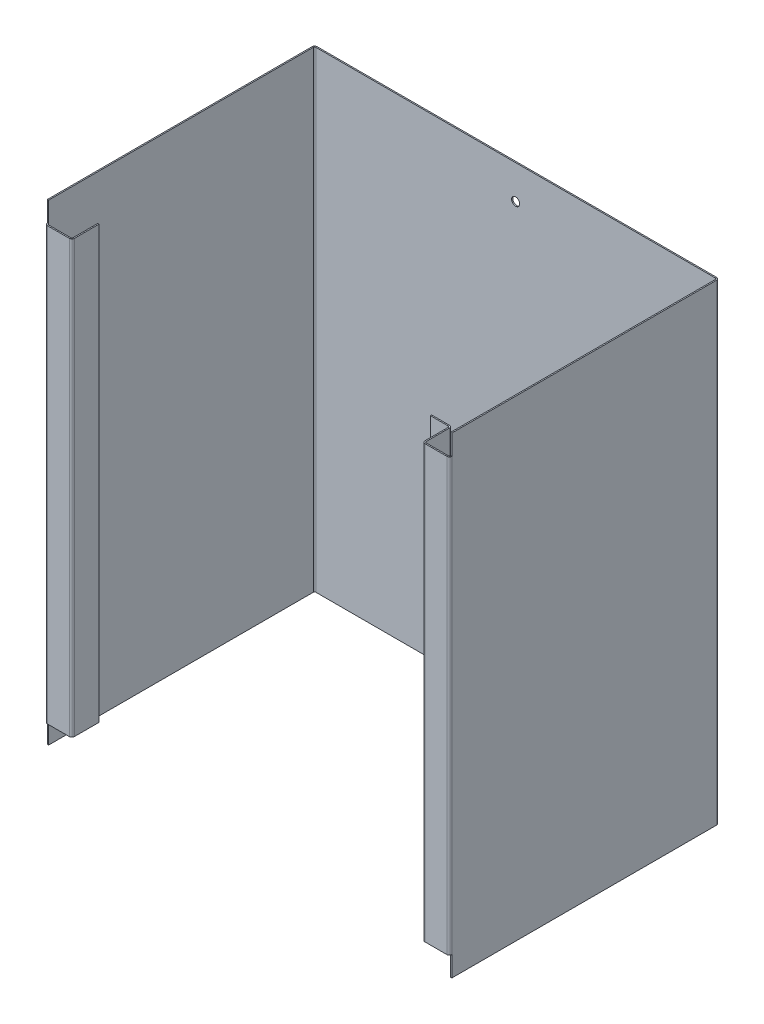
from build123d import *

# Parameters (mm, degrees)
SKETCH1_W                      = 300
SKETCH1_H                      = 350
BASE_FLANGE1_DEPTH             = 0.9
EDGE_FLANGE1_STRIP_W           = 5.4
EDGE_FLANGE1_STRIP_H           = 0.9
EDGE_FLANGE1_STRIP_CUT_DEPTH   = 350
EDGE_FLANGE1_STRIP_2_W         = 5.4
EDGE_FLANGE1_STRIP_2_H         = 0.9
EDGE_FLANGE1_STRIP_CUT_2_DEPTH = 350
EDGE_FLANGE1_DEPTH             = 350
EDGE_FLANGE1_BEND_DEPTH        = 350
EDGE_FLANGE2_STRIP_W           = 5.4
EDGE_FLANGE2_STRIP_H           = 0.9
EDGE_FLANGE2_STRIP_CUT_DEPTH   = 350
EDGE_FLANGE2_STRIP_2_W         = 5.4
EDGE_FLANGE2_STRIP_2_H         = 0.9
EDGE_FLANGE2_STRIP_CUT_2_DEPTH = 350
EDGE_FLANGE2_DEPTH             = 350
EDGE_FLANGE2_BEND_DEPTH        = 350
EDGE_FLANGE3_STRIP_W           = 5.4
EDGE_FLANGE3_STRIP_H           = 0.9
EDGE_FLANGE3_STRIP_CUT_DEPTH   = 350
EDGE_FLANGE3_STRIP_2_W         = 5.4
EDGE_FLANGE3_STRIP_2_H         = 0.9
EDGE_FLANGE3_STRIP_CUT_2_DEPTH = 350
EDGE_FLANGE3_DEPTH             = 350
EDGE_FLANGE3_BEND_DEPTH        = 350
CUT_EXTRUDE1_START             = 160
CUT_EXTRUDE1_DEPTH             = 15
MIRROR2_START                  = 160
MIRROR2_COPY_1_DEPTH           = 15
EDGE_FLANGE4_STRIP_W           = 5.4
EDGE_FLANGE4_STRIP_H           = 0.9
EDGE_FLANGE4_STRIP_CUT_DEPTH   = 320
EDGE_FLANGE4_DEPTH             = 320
SKETCH28_R                     = 3
CUT_EXTRUDE2_DEPTH             = 10


# Read off the part's stored shape, not the designer's step: Cut-Extrude1
# Sheet-metal steps are written as plain solids
with BuildPart() as part:
    # Sketch1 → Base-Flange1 (new body)
    with BuildSketch(Plane.XY):
        Rectangle(SKETCH1_W, SKETCH1_H)
    extrude(amount=-BASE_FLANGE1_DEPTH)

    # Edge-Flange1 strip (across the edge) → Edge-Flange1 strip cut (cut)
    with BuildSketch(Plane(origin=(-150, 175, 0), x_dir=(1, 0, 0), z_dir=(0, -1, 0))):
        with Locations((-0.9, -0.45)):
            Rectangle(EDGE_FLANGE1_STRIP_W, EDGE_FLANGE1_STRIP_H)
    extrude(amount=EDGE_FLANGE1_STRIP_CUT_DEPTH, mode=Mode.SUBTRACT)

    # Edge-Flange1 strip 2 (across the edge) → Edge-Flange1 strip cut 2 (cut)
    with BuildSketch(Plane(origin=(150, -175, 0), x_dir=(-1, 0, 0), z_dir=(0, 1, 0))):
        with Locations((-0.9, -0.45)):
            Rectangle(EDGE_FLANGE1_STRIP_2_W, EDGE_FLANGE1_STRIP_2_H)
    extrude(amount=EDGE_FLANGE1_STRIP_CUT_2_DEPTH, mode=Mode.SUBTRACT)

    # Edge-Flange1 section (across the edge) → Edge-Flange1 (add)
    with BuildSketch(Plane(origin=(-150, 175, 0), x_dir=(1, 0, 0), z_dir=(0, -1, 0))):
        with BuildLine():
            Line((0, 0.9), (0, 199.1))
            Line((0, 199.1), (0.9, 199.1))
            Line((0.9, 199.1), (0.9, 0.9))
            ThreePointArc((0.9, 0.9), (1.163603897, 0.263603897), (1.8, 0))
            Line((1.8, 0), (1.8, -0.9))
            ThreePointArc((1.8, -0.9), (0.527207794, -0.372792206), (0, 0.9))
        make_face()
    extrude(amount=EDGE_FLANGE1_DEPTH)

    # Edge-Flange1 section 2 (across the edge) → Edge-Flange1 bend (add)
    with BuildSketch(Plane(origin=(150, -175, 0), x_dir=(-1, 0, 0), z_dir=(0, 1, 0))):
        with BuildLine():
            Line((0, 0.9), (0, 199.1))
            Line((0, 199.1), (0.9, 199.1))
            Line((0.9, 199.1), (0.9, 0.9))
            ThreePointArc((0.9, 0.9), (1.163603897, 0.263603897), (1.8, 0))
            Line((1.8, 0), (1.8, -0.9))
            ThreePointArc((1.8, -0.9), (0.527207794, -0.372792206), (0, 0.9))
        make_face()
    extrude(amount=EDGE_FLANGE1_BEND_DEPTH)

    # Edge-Flange2 strip (across the edge) → Edge-Flange2 strip cut (cut)
    with BuildSketch(Plane(origin=(-149.1, 175, 199.1), x_dir=(0, 0, -1), z_dir=(0, -1, 0))):
        with Locations((-0.9, -0.45)):
            Rectangle(EDGE_FLANGE2_STRIP_W, EDGE_FLANGE2_STRIP_H)
    extrude(amount=EDGE_FLANGE2_STRIP_CUT_DEPTH, mode=Mode.SUBTRACT)

    # Edge-Flange2 strip 2 (across the edge) → Edge-Flange2 strip cut 2 (cut)
    with BuildSketch(Plane(origin=(149.1, -175, 199.1), x_dir=(0, 0, -1), z_dir=(0, 1, 0))):
        with Locations((-0.9, -0.45)):
            Rectangle(EDGE_FLANGE2_STRIP_2_W, EDGE_FLANGE2_STRIP_2_H)
    extrude(amount=EDGE_FLANGE2_STRIP_CUT_2_DEPTH, mode=Mode.SUBTRACT)

    # Edge-Flange2 section (across the edge) → Edge-Flange2 (add)
    with BuildSketch(Plane(origin=(-149.1, 175, 199.1), x_dir=(0, 0, -1), z_dir=(0, -1, 0))):
        with BuildLine():
            Line((0, 0.9), (0, 19.1))
            Line((0, 19.1), (0.9, 19.1))
            Line((0.9, 19.1), (0.9, 0.9))
            ThreePointArc((0.9, 0.9), (1.163603897, 0.263603897), (1.8, 0))
            Line((1.8, 0), (1.8, -0.9))
            ThreePointArc((1.8, -0.9), (0.527207794, -0.372792206), (0, 0.9))
        make_face()
    extrude(amount=EDGE_FLANGE2_DEPTH)

    # Edge-Flange2 section 2 (across the edge) → Edge-Flange2 bend (add)
    with BuildSketch(Plane(origin=(149.1, -175, 199.1), x_dir=(0, 0, -1), z_dir=(0, 1, 0))):
        with BuildLine():
            Line((0, 0.9), (0, 19.1))
            Line((0, 19.1), (0.9, 19.1))
            Line((0.9, 19.1), (0.9, 0.9))
            ThreePointArc((0.9, 0.9), (1.163603897, 0.263603897), (1.8, 0))
            Line((1.8, 0), (1.8, -0.9))
            ThreePointArc((1.8, -0.9), (0.527207794, -0.372792206), (0, 0.9))
        make_face()
    extrude(amount=EDGE_FLANGE2_BEND_DEPTH)

    # Edge-Flange3 strip (across the edge) → Edge-Flange3 strip cut (cut)
    with BuildSketch(Plane(origin=(130, -175, 198.2), x_dir=(1, 0, 0), z_dir=(0, 1, 0))):
        with Locations((-0.9, -0.45)):
            Rectangle(EDGE_FLANGE3_STRIP_W, EDGE_FLANGE3_STRIP_H)
    extrude(amount=EDGE_FLANGE3_STRIP_CUT_DEPTH, mode=Mode.SUBTRACT)

    # Edge-Flange3 strip 2 (across the edge) → Edge-Flange3 strip cut 2 (cut)
    with BuildSketch(Plane(origin=(-130, 175, 198.2), x_dir=(-1, 0, 0), z_dir=(0, -1, 0))):
        with Locations((-0.9, -0.45)):
            Rectangle(EDGE_FLANGE3_STRIP_2_W, EDGE_FLANGE3_STRIP_2_H)
    extrude(amount=EDGE_FLANGE3_STRIP_CUT_2_DEPTH, mode=Mode.SUBTRACT)

    # Edge-Flange3 section (across the edge) → Edge-Flange3 (add)
    with BuildSketch(Plane(origin=(130, -175, 198.2), x_dir=(1, 0, 0), z_dir=(0, 1, 0))):
        with BuildLine():
            Line((0, 0.9), (0, 19.1))
            Line((0, 19.1), (0.9, 19.1))
            Line((0.9, 19.1), (0.9, 0.9))
            ThreePointArc((0.9, 0.9), (1.163603897, 0.263603897), (1.8, 0))
            Line((1.8, 0), (1.8, -0.9))
            ThreePointArc((1.8, -0.9), (0.527207794, -0.372792206), (0, 0.9))
        make_face()
    extrude(amount=EDGE_FLANGE3_DEPTH)

    # Edge-Flange3 section 2 (across the edge) → Edge-Flange3 bend (add)
    with BuildSketch(Plane(origin=(-130, 175, 198.2), x_dir=(-1, 0, 0), z_dir=(0, -1, 0))):
        with BuildLine():
            Line((0, 0.9), (0, 19.1))
            Line((0, 19.1), (0.9, 19.1))
            Line((0.9, 19.1), (0.9, 0.9))
            ThreePointArc((0.9, 0.9), (1.163603897, 0.263603897), (1.8, 0))
            Line((1.8, 0), (1.8, -0.9))
            ThreePointArc((1.8, -0.9), (0.527207794, -0.372792206), (0, 0.9))
        make_face()
    extrude(amount=EDGE_FLANGE3_BEND_DEPTH)

    # Cut-Extrude1 outline → Cut-Extrude1 (cut)
    with BuildSketch(Plane(origin=(0, 0, 0), x_dir=(1, 0, 0), z_dir=(0, 1, 0)).offset(CUT_EXTRUDE1_START)):
        with BuildLine():
            ThreePointArc((-148.2, -198.2), (-148.836396103, -197.936396103), (-149.1, -197.3))
            Line((-149.1, -197.3), (-150, -197.3))
            ThreePointArc((-150, -197.3), (-149.472792206, -198.572792206), (-148.2, -199.1))
            Line((-148.2, -199.1), (-131.8, -199.1))
            ThreePointArc((-131.8, -199.1), (-130.527207794, -198.572792206), (-130, -197.3))
            Line((-130, -197.3), (-130, -179.1))
            Line((-130, -179.1), (-130.9, -179.1))
            Line((-130.9, -179.1), (-130.9, -197.3))
            ThreePointArc((-130.9, -197.3), (-131.163603897, -197.936396103), (-131.8, -198.2))
            Line((-131.8, -198.2), (-148.2, -198.2))
        make_face()
    cut_extrude1 = extrude(amount=CUT_EXTRUDE1_DEPTH, mode=Mode.SUBTRACT)

    # Mirror1: Cut-Extrude1 across plane
    add(cut_extrude1.mirror(Plane(origin=(0, 0, 0), x_dir=(0, 0, 1), z_dir=(1, 0, 0))), mode=Mode.SUBTRACT)

    # Mirror2: Cut-Extrude1 across plane
    add(cut_extrude1.mirror(Plane.ZX), mode=Mode.SUBTRACT)

    # Mirror2 copy 1 sketch → Mirror2 copy 1 (cut)
    with BuildSketch(Plane(origin=(0, 0, 0), x_dir=(-1, 0, 0), z_dir=(0, -1, 0)).offset(MIRROR2_START)):
        with BuildLine():
            ThreePointArc((-148.2, -198.2), (-148.836396103, -197.936396103), (-149.1, -197.3))
            Line((-149.1, -197.3), (-150, -197.3))
            ThreePointArc((-150, -197.3), (-149.472792206, -198.572792206), (-148.2, -199.1))
            Line((-148.2, -199.1), (-131.8, -199.1))
            ThreePointArc((-131.8, -199.1), (-130.527207794, -198.572792206), (-130, -197.3))
            Line((-130, -197.3), (-130, -179.1))
            Line((-130, -179.1), (-130.9, -179.1))
            Line((-130.9, -179.1), (-130.9, -197.3))
            ThreePointArc((-130.9, -197.3), (-131.163603897, -197.936396103), (-131.8, -198.2))
            Line((-131.8, -198.2), (-148.2, -198.2))
        make_face()
    extrude(amount=MIRROR2_COPY_1_DEPTH, mode=Mode.SUBTRACT)

    # Edge-Flange4 strip (across the edge) → Edge-Flange4 strip cut (cut)
    with BuildSketch(Plane(origin=(130, 160, 179.1), x_dir=(0, 0, 1), z_dir=(0, -1, 0))):
        with Locations((-1.8, -0.45)):
            Rectangle(EDGE_FLANGE4_STRIP_W, EDGE_FLANGE4_STRIP_H)
    extrude(amount=EDGE_FLANGE4_STRIP_CUT_DEPTH, mode=Mode.SUBTRACT)

    # Edge-Flange4 section (across the edge) → Edge-Flange4 (add)
    with BuildSketch(Plane(origin=(130, 160, 179.1), x_dir=(0, 0, 1), z_dir=(0, -1, 0))):
        with BuildLine():
            Line((-0.9, 0.9), (-0.9, 14.1))
            Line((-0.9, 14.1), (0, 14.1))
            Line((0, 14.1), (0, 0.9))
            ThreePointArc((0, 0.9), (0.263603897, 0.263603897), (0.9, 0))
            Line((0.9, 0), (0.9, -0.9))
            ThreePointArc((0.9, -0.9), (-0.372792206, -0.372792206), (-0.9, 0.9))
        make_face()
    extrude(amount=EDGE_FLANGE4_DEPTH)

    # Sketch28 → Cut-Extrude2 (cut)
    with BuildSketch(Plane(origin=(0, 0, -0.9), x_dir=(-1, 0, 0), z_dir=(0, 0, -1))):
        with Locations((0, 150)):
            Circle(SKETCH28_R)
        with Locations((0, -150)):
            Circle(SKETCH28_R)
    extrude(amount=-CUT_EXTRUDE2_DEPTH, mode=Mode.SUBTRACT)


solid = part.part
